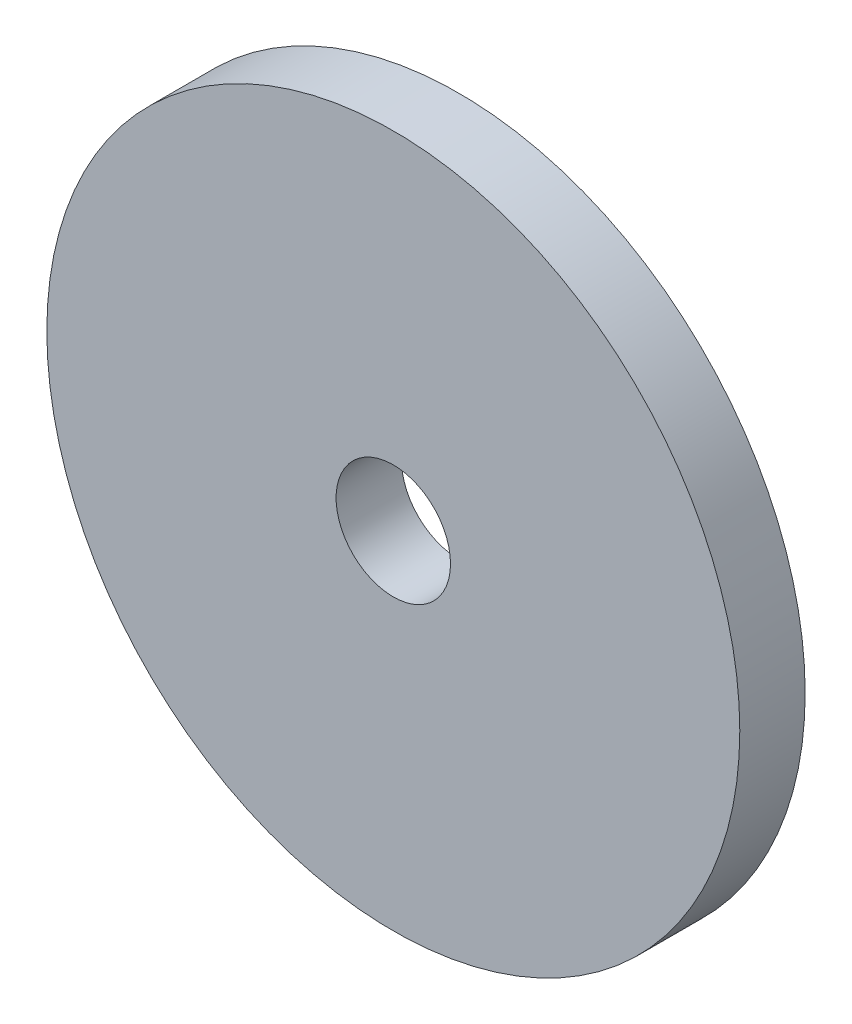
from build123d import *

# Parameters (mm, degrees)
ESBO_O1_R                = 21.2
ESBO_O1_R_2              = 3.5
RESSALTO_EXTRUS_O1_DEPTH = 4


with BuildPart() as part:
    # Esboço1 → Ressalto-extrusão1 (new body)
    with BuildSketch(Plane.XY):
        Circle(ESBO_O1_R)
        Circle(ESBO_O1_R_2, mode=Mode.SUBTRACT)
    extrude(amount=RESSALTO_EXTRUS_O1_DEPTH)


solid = part.part
